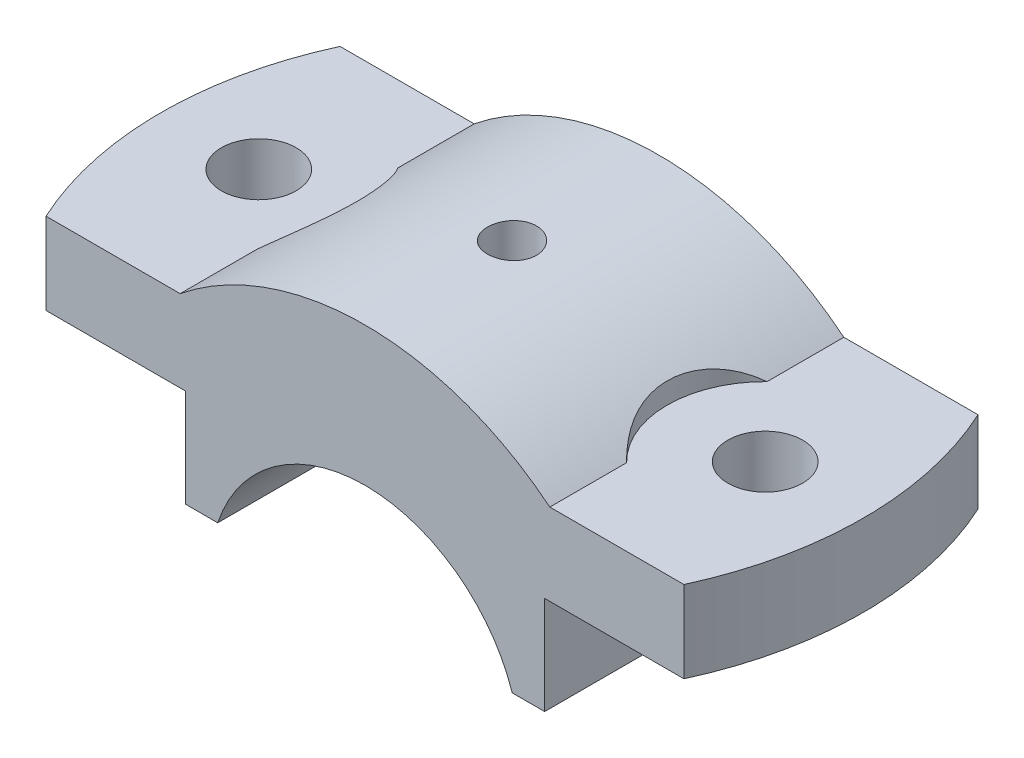
from build123d import *

# Parameters (mm, degrees)
BOSS_EXTRUDE2_DEPTH     = 18
CUT_EXTRUDE1_START      = -10
CUT_EXTRUDE1_DEPTH      = 10
SKETCH4_R               = 4.577705579
CUT_EXTRUDE2_DEPTH      = 52.544224249
CUT_EXTRUDE3_DEPTH      = 52.544224249
SKETCH6_R               = 3
CUT_EXTRUDE4_DEPTH      = 10
CUT_EXTRUDE5_REACH      = 52.723
CUT_EXTRUDE5_END_RADIUS = 19
SKETCH7_R               = 1.5


# Read off the part's stored shape, not the designer's step: Cut-Extrude1
with BuildPart() as part:
    # Sketch1 → Boss-Extrude2 (new, symmetric)
    with BuildSketch(Plane.XY):
        with BuildLine():
            Line((18.027756377, -13), (21.997756377, -13))
            Line((21.997756377, -13), (21.997756377, -1))
            Line((21.997756377, -1), (42.997756377, -1))
            Line((42.997756377, -1), (42.997756377, 9))
            Line((42.997756377, 9), (22.627416998, 9))
            ThreePointArc((22.627416998, 9), (0, 17), (-22.627416998, 9))
            Line((-22.627416998, 9), (-42.997756377, 9))
            Line((-42.997756377, 9), (-42.997756377, -1))
            Line((-42.997756377, -1), (-21.997756377, -1))
            Line((-21.997756377, -1), (-21.997756377, -13))
            Line((-21.997756377, -13), (-18.027756377, -13))
            ThreePointArc((-18.027756377, -13), (0, 0), (18.027756377, -13))
        make_face()
    extrude(amount=BOSS_EXTRUDE2_DEPTH, both=True)

    # Cut-Extrude1 outline → Cut-Extrude1 (cut)
    with BuildSketch(Plane(origin=(0, 9, 0), x_dir=(1, 0, 0), z_dir=(0, 1, 0)).offset(CUT_EXTRUDE1_START)):
        with BuildLine():
            ThreePointArc((42.997756377, 0), (41.998910053, -9.214044053), (39.048777874, -18))
            Line((39.048777874, -18), (42.997756377, -18))
            Line((42.997756377, -18), (42.997756377, 0))
        make_face()
        with BuildLine():
            ThreePointArc((39.048777874, 18), (41.998910053, 9.214044053), (42.997756377, 0))
            Line((42.997756377, 0), (42.997756377, 18))
            Line((42.997756377, 18), (39.048777874, 18))
        make_face()
        with BuildLine():
            Line((-42.997756377, -18), (-39.048777874, -18))
            ThreePointArc((-39.048777874, -18), (-41.998910053, -9.214044053), (-42.997756377, 0))
            Line((-42.997756377, 0), (-42.997756377, -18))
        make_face()
        with BuildLine():
            Line((-42.997756377, 18), (-42.997756377, 0))
            ThreePointArc((-42.997756377, 0), (-41.998910053, 9.214044053), (-39.048777874, 18))
            Line((-39.048777874, 18), (-42.997756377, 18))
        make_face()
    extrude(amount=CUT_EXTRUDE1_DEPTH, mode=Mode.SUBTRACT)

    # Sketch4 → Cut-Extrude2 (cut, through all)
    with BuildSketch(Plane(origin=(0, 9, 0), x_dir=(1, 0, 0), z_dir=(0, 1, 0))):
        with Locations(Location((-31, 0, 0), (0, 0, 180))):
            Circle(SKETCH4_R)
        with Locations(Location((31, 0, 0), (0, 0, 270))):
            Circle(SKETCH4_R)
    extrude(amount=-CUT_EXTRUDE2_DEPTH, mode=Mode.SUBTRACT)

    # Sketch5 → Cut-Extrude3 (cut, through all)
    with BuildSketch(Plane(origin=(0, 9, 0), x_dir=(1, 0, 0), z_dir=(0, 1, 0))):
        with BuildLine():
            Line((-22.627416998, 8.593370233), (-22.627416998, -8.593370233))
            ThreePointArc((-22.627416998, -8.593370233), (-19.002243623, 0), (-22.627416998, 8.593370233))
        make_face()
        with BuildLine():
            Line((22.627416998, 8.593370233), (22.627416998, -8.593370233))
            ThreePointArc((22.627416998, -8.593370233), (19.002243623, 0), (22.627416998, 8.593370233))
        make_face()
    extrude(amount=CUT_EXTRUDE3_DEPTH, mode=Mode.SUBTRACT)

    # Sketch6 → Cut-Extrude4 (cut)
    with BuildSketch(Plane(origin=(0, 17, 0), x_dir=(1, 0, 0), z_dir=(0, 1, 0))):
        with Locations(Location((0, 0, 0), (0, 0, 270))):
            Circle(SKETCH6_R)
    extrude(amount=-CUT_EXTRUDE4_DEPTH, mode=Mode.SUBTRACT)

    # Cut-Extrude5: up to this cylinder (the profile starts outside it)
    cut_extrude5_end = Plane(origin=(0, -19, 0), z_dir=(0, 0, -1)) * Cylinder(CUT_EXTRUDE5_END_RADIUS, 144.446, mode=Mode.PRIVATE)
    # Sketch7 → Cut-Extrude5 (cut, up to the surface)
    with BuildSketch(Plane(origin=(0, 7, 0), x_dir=(1, 0, 0), z_dir=(0, 1, 0)), mode=Mode.PRIVATE) as cut_extrude5_sk1:
        with Locations(Location((0, 0, 0), (0, 0, 270))):
            Circle(SKETCH7_R)
    cut_extrude5_tool1 = extrude(cut_extrude5_sk1.sketch, amount=-CUT_EXTRUDE5_REACH, mode=Mode.PRIVATE) - cut_extrude5_end
    add(cut_extrude5_tool1.solids().sort_by_distance((0, 7, 0))[0], mode=Mode.SUBTRACT)


solid = part.part
